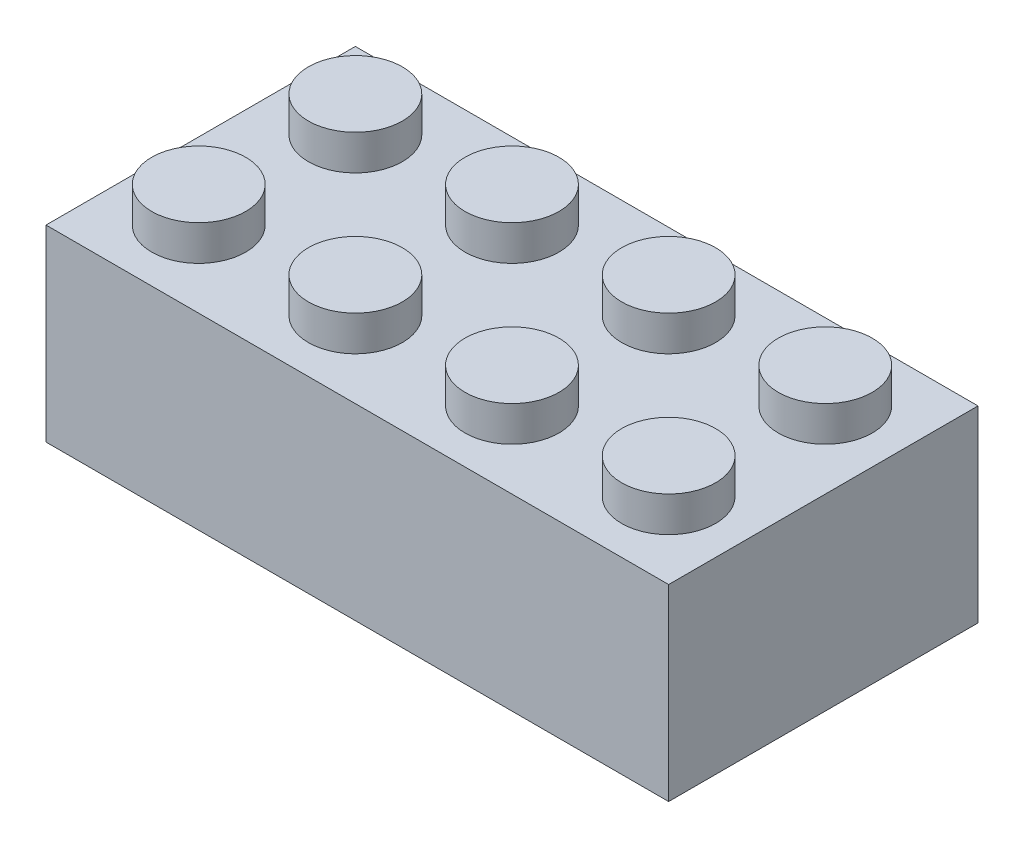
from build123d import *

# Parameters (mm, degrees)
EXTRUDE_THIN1_OUTLINE_W   = 31.8
EXTRUDE_THIN1_OUTLINE_H   = 15.8
EXTRUDE_THIN1_OUTLINE_W_2 = 29.4
EXTRUDE_THIN1_OUTLINE_H_2 = 13.4
EXTRUDE_THIN1_OUTLINE_R   = 3.25
EXTRUDE_THIN1_OUTLINE_R_2 = 2.05
EXTRUDE_THIN1_DEPTH       = 9.6
BOSS_EXTRUDE1_START       = 8.6
SKETCH1_3_R               = 1.3
SKETCH1_3_R_2             = 3.25
SKETCH1_3_R_3             = 2.05
BOSS_EXTRUDE1_DEPTH       = 1
EXTRUDE_THIN2_START       = 9.6
SKETCH1_4_R               = 2.4
SKETCH1_4_R_2             = 1.3
EXTRUDE_THIN2_DEPTH       = 1.8
BOSS_EXTRUDE2_START       = 10.3
SKETCH1_5_R               = 1.3
BOSS_EXTRUDE2_DEPTH       = 1.1
EXTRUDE_THIN3_START       = 8.6
SKETCH1_7_W               = 1.1
SKETCH1_7_H               = 5.65
EXTRUDE_THIN3_DEPTH       = 6.3
SKETCH1_8_W               = 1.2
SKETCH1_8_H               = 1.4
SKETCH1_8_W_2             = 1.4
SKETCH1_8_H_2             = 1.2
EXTRUDE_THIN4_DEPTH       = 8.6


# Read off the part's stored shape, not the designer's step: Extrude-Thin1
with BuildPart() as part:
    # Extrude-Thin1 outline → Extrude-Thin1 (new body)
    # profile 1 of 4: a face of its own
    with BuildSketch(Plane(origin=(0, 0, 0), x_dir=(1, 0, 0), z_dir=(0, 1, 0))):
        Rectangle(EXTRUDE_THIN1_OUTLINE_W, EXTRUDE_THIN1_OUTLINE_H)
        Rectangle(EXTRUDE_THIN1_OUTLINE_W_2, EXTRUDE_THIN1_OUTLINE_H_2, mode=Mode.SUBTRACT)
    # profile 2 of 4: a face of its own
    with BuildSketch(Plane(origin=(0, 0, 0), x_dir=(1, 0, 0), z_dir=(0, 1, 0))):
        with Locations((-8, 0)):
            Circle(EXTRUDE_THIN1_OUTLINE_R)
        with Locations((-8, 0)):
            Circle(EXTRUDE_THIN1_OUTLINE_R_2, mode=Mode.SUBTRACT)
    # profile 3 of 4: a face of its own
    with BuildSketch(Plane(origin=(0, 0, 0), x_dir=(1, 0, 0), z_dir=(0, 1, 0))):
        Circle(EXTRUDE_THIN1_OUTLINE_R)
        Circle(EXTRUDE_THIN1_OUTLINE_R_2, mode=Mode.SUBTRACT)
    # profile 4 of 4: a face of its own
    with BuildSketch(Plane(origin=(0, 0, 0), x_dir=(1, 0, 0), z_dir=(0, 1, 0))):
        with Locations((8, 0)):
            Circle(EXTRUDE_THIN1_OUTLINE_R)
        with Locations((8, 0)):
            Circle(EXTRUDE_THIN1_OUTLINE_R_2, mode=Mode.SUBTRACT)
    extrude(amount=EXTRUDE_THIN1_DEPTH)

    # Sketch1<3> → Boss-Extrude1 (add)
    # profile 1 of 4: a face of its own
    with BuildSketch(Plane(origin=(0, 0, 0), x_dir=(1, 0, 0), z_dir=(0, 1, 0)).offset(BOSS_EXTRUDE1_START)):
        Polygon((4, 6.7), (-4, 6.7), (-12, 6.7), (-14.7, 6.7), (-14.7, 4), (-14.7, -4), (-14.7, -6.7), (-12, -6.7), (-4, -6.7), (4, -6.7), (12, -6.7), (14.7, -6.7), (14.7, -4), (14.7, 4), (14.7, 6.7), (12, 6.7), align=None)
        with BuildLine():
            ThreePointArc((3.25, 0), (0, -3.25), (-3.25, 0))
            ThreePointArc((-3.25, 0), (0, 3.25), (3.25, 0))
        make_face(mode=Mode.SUBTRACT)
        with Locations(Location((4, -4, 0), (0, 0, 270))):
            Circle(SKETCH1_3_R, mode=Mode.SUBTRACT)
        with Locations(Location((12, -4, 0), (0, 0, 270))):
            Circle(SKETCH1_3_R, mode=Mode.SUBTRACT)
        with Locations(Location((4, 4, 0), (0, 0, 270))):
            Circle(SKETCH1_3_R, mode=Mode.SUBTRACT)
        with Locations(Location((8, 0, 0), (0, 0, 270))):
            Circle(SKETCH1_3_R_2, mode=Mode.SUBTRACT)
        with Locations(Location((12, 4, 0), (0, 0, 270))):
            Circle(SKETCH1_3_R, mode=Mode.SUBTRACT)
        with Locations(Location((-12, -4, 0), (0, 0, 270))):
            Circle(SKETCH1_3_R, mode=Mode.SUBTRACT)
        with Locations(Location((-4, -4, 0), (0, 0, 270))):
            Circle(SKETCH1_3_R, mode=Mode.SUBTRACT)
        with Locations(Location((-8, 0, 0), (0, 0, 270))):
            Circle(SKETCH1_3_R_2, mode=Mode.SUBTRACT)
        with Locations(Location((-12, 4, 0), (0, 0, 270))):
            Circle(SKETCH1_3_R, mode=Mode.SUBTRACT)
        with Locations(Location((-4, 4, 0), (0, 0, 270))):
            Circle(SKETCH1_3_R, mode=Mode.SUBTRACT)
    # profile 2 of 4: a face of its own
    with BuildSketch(Plane(origin=(0, 0, 0), x_dir=(1, 0, 0), z_dir=(0, 1, 0)).offset(BOSS_EXTRUDE1_START)):
        with Locations((8, 0)):
            Circle(SKETCH1_3_R_3)
    # profile 3 of 4: a face of its own
    with BuildSketch(Plane(origin=(0, 0, 0), x_dir=(1, 0, 0), z_dir=(0, 1, 0)).offset(BOSS_EXTRUDE1_START)):
        Circle(SKETCH1_3_R_3)
    # profile 4 of 4: a face of its own
    with BuildSketch(Plane(origin=(0, 0, 0), x_dir=(1, 0, 0), z_dir=(0, 1, 0)).offset(BOSS_EXTRUDE1_START)):
        with Locations((-8, 0)):
            Circle(SKETCH1_3_R_3)
    extrude(amount=BOSS_EXTRUDE1_DEPTH)

    # Sketch1<4> → Extrude-Thin2 (add)
    # profile 1 of 8: a face of its own
    with BuildSketch(Plane(origin=(0, 0, 0), x_dir=(1, 0, 0), z_dir=(0, 1, 0)).offset(EXTRUDE_THIN2_START)):
        with Locations((-12, 4)):
            Circle(SKETCH1_4_R)
        with Locations((-12, 4)):
            Circle(SKETCH1_4_R_2, mode=Mode.SUBTRACT)
    # profile 2 of 8: a face of its own
    with BuildSketch(Plane(origin=(0, 0, 0), x_dir=(1, 0, 0), z_dir=(0, 1, 0)).offset(EXTRUDE_THIN2_START)):
        with Locations((-4, 4)):
            Circle(SKETCH1_4_R)
        with Locations((-4, 4)):
            Circle(SKETCH1_4_R_2, mode=Mode.SUBTRACT)
    # profile 3 of 8: a face of its own
    with BuildSketch(Plane(origin=(0, 0, 0), x_dir=(1, 0, 0), z_dir=(0, 1, 0)).offset(EXTRUDE_THIN2_START)):
        with Locations((4, 4)):
            Circle(SKETCH1_4_R)
        with Locations((4, 4)):
            Circle(SKETCH1_4_R_2, mode=Mode.SUBTRACT)
    # profile 4 of 8: a face of its own
    with BuildSketch(Plane(origin=(0, 0, 0), x_dir=(1, 0, 0), z_dir=(0, 1, 0)).offset(EXTRUDE_THIN2_START)):
        with Locations((12, 4)):
            Circle(SKETCH1_4_R)
        with Locations((12, 4)):
            Circle(SKETCH1_4_R_2, mode=Mode.SUBTRACT)
    # profile 5 of 8: a face of its own
    with BuildSketch(Plane(origin=(0, 0, 0), x_dir=(1, 0, 0), z_dir=(0, 1, 0)).offset(EXTRUDE_THIN2_START)):
        with Locations((12, -4)):
            Circle(SKETCH1_4_R)
        with Locations((12, -4)):
            Circle(SKETCH1_4_R_2, mode=Mode.SUBTRACT)
    # profile 6 of 8: a face of its own
    with BuildSketch(Plane(origin=(0, 0, 0), x_dir=(1, 0, 0), z_dir=(0, 1, 0)).offset(EXTRUDE_THIN2_START)):
        with Locations((4, -4)):
            Circle(SKETCH1_4_R)
        with Locations((4, -4)):
            Circle(SKETCH1_4_R_2, mode=Mode.SUBTRACT)
    # profile 7 of 8: a face of its own
    with BuildSketch(Plane(origin=(0, 0, 0), x_dir=(1, 0, 0), z_dir=(0, 1, 0)).offset(EXTRUDE_THIN2_START)):
        with Locations((-4, -4)):
            Circle(SKETCH1_4_R)
        with Locations((-4, -4)):
            Circle(SKETCH1_4_R_2, mode=Mode.SUBTRACT)
    # profile 8 of 8: a face of its own
    with BuildSketch(Plane(origin=(0, 0, 0), x_dir=(1, 0, 0), z_dir=(0, 1, 0)).offset(EXTRUDE_THIN2_START)):
        with Locations((-12, -4)):
            Circle(SKETCH1_4_R)
        with Locations((-12, -4)):
            Circle(SKETCH1_4_R_2, mode=Mode.SUBTRACT)
    extrude(amount=EXTRUDE_THIN2_DEPTH)

    # Sketch1<5> → Boss-Extrude2 (add)
    with BuildSketch(Plane(origin=(0, 0, 0), x_dir=(1, 0, 0), z_dir=(0, 1, 0)).offset(BOSS_EXTRUDE2_START)):
        with Locations(Location((-12, -4, 0), (0, 0, 270))):
            Circle(SKETCH1_5_R)
        with Locations(Location((-12, 4, 0), (0, 0, 270))):
            Circle(SKETCH1_5_R)
        with Locations(Location((-4, 4, 0), (0, 0, 270))):
            Circle(SKETCH1_5_R)
        with Locations(Location((-4, -4, 0), (0, 0, 270))):
            Circle(SKETCH1_5_R)
        with Locations(Location((4, -4, 0), (0, 0, 270))):
            Circle(SKETCH1_5_R)
        with Locations(Location((4, 4, 0), (0, 0, 270))):
            Circle(SKETCH1_5_R)
        with Locations(Location((12, 4, 0), (0, 0, 270))):
            Circle(SKETCH1_5_R)
        with Locations(Location((12, -4, 0), (0, 0, 270))):
            Circle(SKETCH1_5_R)
    extrude(amount=BOSS_EXTRUDE2_DEPTH)

    # Sketch1<7> → Extrude-Thin3 (add)
    with BuildSketch(Plane(origin=(0, 0, 0), x_dir=(1, 0, 0), z_dir=(0, 1, 0)).offset(EXTRUDE_THIN3_START)):
        with Locations((0, 5.075)):
            Rectangle(SKETCH1_7_W, SKETCH1_7_H)
        with Locations((0, -5.075)):
            Rectangle(SKETCH1_7_W, SKETCH1_7_H)
    extrude(amount=-EXTRUDE_THIN3_DEPTH)

    # Sketch1<8> → Extrude-Thin4 (add)
    with BuildSketch(Plane(origin=(0, 0, 0), x_dir=(1, 0, 0), z_dir=(0, 1, 0))):
        with Locations((4, -7.2)):
            Rectangle(SKETCH1_8_W, SKETCH1_8_H)
        with Locations((12, -7.2)):
            Rectangle(SKETCH1_8_W, SKETCH1_8_H)
        with Locations((15.2, -4)):
            Rectangle(SKETCH1_8_W_2, SKETCH1_8_H_2)
        with Locations((15.2, 4)):
            Rectangle(SKETCH1_8_W_2, SKETCH1_8_H_2)
        with Locations((12, 7.2)):
            Rectangle(SKETCH1_8_W, SKETCH1_8_H)
        with Locations((4, 7.2)):
            Rectangle(SKETCH1_8_W, SKETCH1_8_H)
        with Locations((-4, 7.2)):
            Rectangle(SKETCH1_8_W, SKETCH1_8_H)
        with Locations((-12, 7.2)):
            Rectangle(SKETCH1_8_W, SKETCH1_8_H)
        with Locations((-15.2, 4)):
            Rectangle(SKETCH1_8_W_2, SKETCH1_8_H_2)
        with Locations((-15.2, -4)):
            Rectangle(SKETCH1_8_W_2, SKETCH1_8_H_2)
        with Locations((-12, -7.2)):
            Rectangle(SKETCH1_8_W, SKETCH1_8_H)
        with Locations((-4, -7.2)):
            Rectangle(SKETCH1_8_W, SKETCH1_8_H)
    extrude(amount=EXTRUDE_THIN4_DEPTH)


solid = part.part
